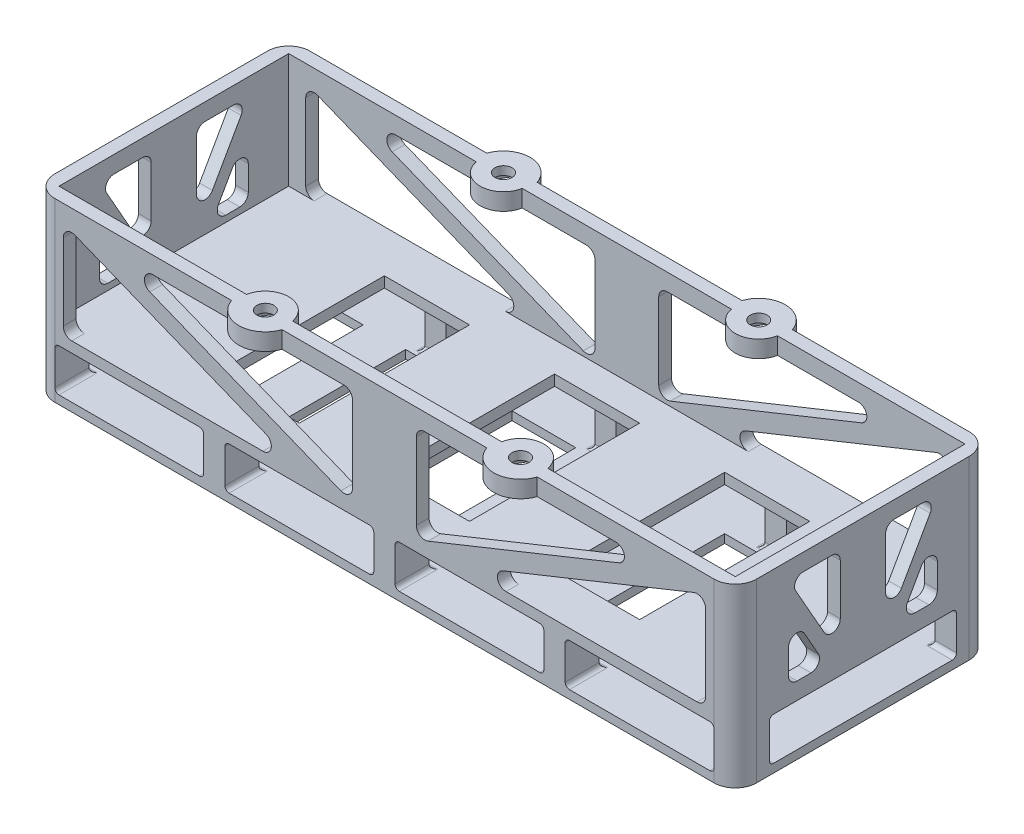
from build123d import *

# Parameters (mm, degrees)
SKETCH_1_W               = 165
SKETCH_1_H               = 60
SKETCH_1_W_2             = 20
SKETCH_1_H_2             = 40
EXTRUDE_1_DEPTH          = 2.5
EXTRUDE_3_DEPTH          = 27
CUT_EXTRUDE_3_DEPTH      = 102.630458033
CUT_EXTRUDE_3_DEPTH_BACK = 102.630458033
SKETCH_21_R              = 6.25
EXTRUDE_6_DEPTH          = 4
CUT_EXTRUDE_4_DEPTH      = 169.188324506
CUT_EXTRUDE_4_DEPTH_BACK = 169.188324506
SKETCH_15_R              = 2
CUT_EXTRUDE_5_DEPTH      = 93.895438532
CUT_EXTRUDE_START        = -27
CUT_EXTRUDE_6_DEPTH      = 27
CUT_EXTRUDE_7_DEPTH      = 2
SKETCH_18_W              = 158.987632604
SKETCH_18_H              = 54
CUT_EXTRUDE_8_DEPTH      = 15
SKETCH_19_W              = 5
SKETCH_19_H              = 8
SKETCH_19_H_2            = 7.99069016
EXTRUDE_4_DEPTH          = 10
SKETCH_20_W              = 165
SKETCH_20_H              = 60
SKETCH_20_W_2            = 15
SKETCH_20_H_2            = 40
EXTRUDE_5_DEPTH          = 2
FILLET_2_R               = 2
FILLET_3_R               = 5
FILLET_4_R               = 1


with BuildPart() as part:
    # 草圖1 → 填料-伸長1 (new body)
    with BuildSketch(Plane(origin=(0, 0, 0), x_dir=(1, 0, 0), z_dir=(0, 1, 0))):
        Rectangle(SKETCH_1_W, SKETCH_1_H)
        with Locations((40, 0)):
            Rectangle(SKETCH_1_W_2, SKETCH_1_H_2, mode=Mode.SUBTRACT)
        Rectangle(SKETCH_1_W_2, SKETCH_1_H_2, mode=Mode.SUBTRACT)
        with Locations((-40, 0)):
            Rectangle(SKETCH_1_W_2, SKETCH_1_H_2, mode=Mode.SUBTRACT)
    extrude(amount=EXTRUDE_1_DEPTH)

    # 草圖3 → 填料-伸長3 (add)
    with BuildSketch(Plane(origin=(0, 2.5, 0), x_dir=(1, 0, 0), z_dir=(0, 1, 0))):
        Polygon((-82.5, -30), (-20, -30), (20, -30), (82.5, -30), (82.5, 0), (82.5, 30), (20, 30), (-20, 30), (-82.5, 30), (-82.5, 0), align=None)
        Polygon((-20, -21.5), (-79.5, -21.5), (-79.5, 0), (-79.5, 21.5), (-20, 21.5), (20, 21.5), (79.5, 21.5), (79.5, 0), (79.5, -21.5), (20, -21.5), align=None, mode=Mode.SUBTRACT)
    extrude(amount=EXTRUDE_3_DEPTH)

    # 草圖6 → 除料-伸長3 (cut, two sides: drawn at the far end of the back side and taken through both)
    with BuildSketch(Plane.XY.offset(-21.5).offset(-CUT_EXTRUDE_3_DEPTH_BACK)):
        Polygon((-64.767243955, 25.5), (-7.5, 25.5), (-7.5, 2.5), align=None)
        Polygon((-75.5, 25.5), (-75.5, 2.5), (-18.232756045, 2.5), align=None)
        Polygon((7.5, 25.5), (7.5, 2.5), (64.767243955, 25.5), align=None)
        Polygon((75.5, 2.5), (18.232756045, 2.5), (75.5, 25.5), align=None)
    extrude(amount=CUT_EXTRUDE_3_DEPTH + CUT_EXTRUDE_3_DEPTH_BACK, mode=Mode.SUBTRACT)

    # 草圖21 → 填料-伸長6 (add)
    with BuildSketch(Plane(origin=(0, 29.5, 0), x_dir=(1, 0, 0), z_dir=(0, 1, 0))):
        with Locations((-30, 28)):
            Circle(SKETCH_21_R)
        with Locations((30, 28)):
            Circle(SKETCH_21_R)
        with Locations((30, -28)):
            Circle(SKETCH_21_R)
        with Locations((-30, -28)):
            Circle(SKETCH_21_R)
    extrude(amount=-EXTRUDE_6_DEPTH)

    # 草圖7 → 除料-伸長4 (cut, two sides: drawn at the far end of the back side and taken through both)
    with BuildSketch(Plane.ZY.offset(-79.5).offset(-CUT_EXTRUDE_4_DEPTH_BACK)):
        Polygon((17.5, 25.5), (5.321878443, 4), (5.321878443, 25.5), align=None)
        Polygon((-5.321878443, 4), (-5.321878443, 25.5), (-17.5, 25.5), align=None)
        Polygon((17.5, 4), (8.7697079, 4), (17.5, 19.41299118), align=None)
        Polygon((-17.5, 19.41299118), (-17.5, 4), (-8.7697079, 4), align=None)
    extrude(amount=CUT_EXTRUDE_4_DEPTH + CUT_EXTRUDE_4_DEPTH_BACK, mode=Mode.SUBTRACT)

    # 草圖15 → 除料-伸長5 (cut, through all)
    with BuildSketch(Plane.XZ.offset(-25.5)):
        with Locations((30, 28)):
            Circle(SKETCH_15_R)
        with Locations(Location((-30, 28, 0), (0, 0, 180))):
            Circle(SKETCH_15_R)
        with Locations(Location((30, -28, 0), (0, 0, 180))):
            Circle(SKETCH_15_R)
        with Locations((-30, -28)):
            Circle(SKETCH_15_R)
    extrude(amount=-CUT_EXTRUDE_5_DEPTH, mode=Mode.SUBTRACT)

    # 草圖16 → 除料-伸長6 (cut)
    with BuildSketch(Plane(origin=(0, 29.5, 0), x_dir=(1, 0, 0), z_dir=(0, 1, 0)).offset(CUT_EXTRUDE_START)):
        with BuildLine():
            Line((-35.408326913, 27), (-79.5, 27))
            Line((-79.5, 27), (-79.5, -27))
            Line((-79.5, -27), (-35.408326913, -27))
            ThreePointArc((-35.408326913, -27), (-30, -22.5), (-24.591673087, -27))
            Line((-24.591673087, -27), (24.591673087, -27))
            ThreePointArc((24.591673087, -27), (30, -22.5), (35.408326913, -27))
            Line((35.408326913, -27), (79.5, -27))
            Line((79.5, -27), (79.5, 27))
            Line((79.5, 27), (35.408326913, 27))
            ThreePointArc((35.408326913, 27), (30, 22.5), (24.591673087, 27))
            Line((24.591673087, 27), (-24.591673087, 27))
            ThreePointArc((-24.591673087, 27), (-30, 22.5), (-35.408326913, 27))
        make_face()
    extrude(amount=CUT_EXTRUDE_6_DEPTH, mode=Mode.SUBTRACT)

    # 草圖17 → 除料-伸長7 (cut)
    with BuildSketch(Plane.XZ.offset(-25.5)):
        Polygon((25.438932873, 28), (27.719466437, 31.95), (32.280533563, 31.95), (34.561067127, 28), (32.280533563, 24.05), (27.719466437, 24.05), align=None)
        Polygon((-27.719466437, 31.95), (-32.280533563, 31.95), (-34.561067127, 28), (-32.280533563, 24.05), (-27.719466437, 24.05), (-25.438932873, 28), align=None)
        Polygon((27.719466437, -31.95), (32.280533563, -31.95), (34.561067127, -28), (32.280533563, -24.05), (27.719466437, -24.05), (25.438932873, -28), align=None)
        Polygon((-25.438932873, -28), (-27.719466437, -31.95), (-32.280533563, -31.95), (-34.561067127, -28), (-32.280533563, -24.05), (-27.719466437, -24.05), align=None)
    extrude(amount=-CUT_EXTRUDE_7_DEPTH, mode=Mode.SUBTRACT)

    # 草圖18 → 除料-伸長8 (cut)
    with BuildSketch(Plane(origin=(0, 2.5, 0), x_dir=(1, 0, 0), z_dir=(0, 1, 0))):
        Rectangle(SKETCH_18_W, SKETCH_18_H)
    extrude(amount=CUT_EXTRUDE_8_DEPTH, mode=Mode.SUBTRACT)

    # 草圖19 → 填料-伸長4 (add)
    with BuildSketch(Plane.XZ):
        with Locations((-80, 26)):
            Rectangle(SKETCH_19_W, SKETCH_19_H)
        with Locations((-80, -26)):
            Rectangle(SKETCH_19_W, SKETCH_19_H)
        with Locations((80, -26)):
            Rectangle(SKETCH_19_W, SKETCH_19_H)
        with Locations((80, 26)):
            Rectangle(SKETCH_19_W, SKETCH_19_H)
        with Locations((40, -26)):
            Rectangle(SKETCH_19_W, SKETCH_19_H)
        with Locations((-40, 26.00465492)):
            Rectangle(SKETCH_19_W, SKETCH_19_H_2)
        with Locations((0, 26)):
            Rectangle(SKETCH_19_W, SKETCH_19_H)
        with Locations((40, 26)):
            Rectangle(SKETCH_19_W, SKETCH_19_H)
        with Locations((0, -26)):
            Rectangle(SKETCH_19_W, SKETCH_19_H)
        with Locations((-40, -26.00465492)):
            Rectangle(SKETCH_19_W, SKETCH_19_H_2)
    extrude(amount=EXTRUDE_4_DEPTH)

    # 草圖20 → 填料-伸長5 (add)
    with BuildSketch(Plane.XZ.offset(10)):
        Rectangle(SKETCH_20_W, SKETCH_20_H)
        with Locations((12.5, 0)):
            Rectangle(SKETCH_20_W_2, SKETCH_20_H_2, mode=Mode.SUBTRACT)
        with Locations((-12.5, 0)):
            Rectangle(SKETCH_20_W_2, SKETCH_20_H_2, mode=Mode.SUBTRACT)
        with Locations((37.5, 0)):
            Rectangle(SKETCH_20_W_2, SKETCH_20_H_2, mode=Mode.SUBTRACT)
        with Locations((62.5, 0)):
            Rectangle(SKETCH_20_W_2, SKETCH_20_H_2, mode=Mode.SUBTRACT)
        with Locations((-62.5, 0)):
            Rectangle(SKETCH_20_W_2, SKETCH_20_H_2, mode=Mode.SUBTRACT)
        with Locations((-37.5, 0)):
            Rectangle(SKETCH_20_W_2, SKETCH_20_H_2, mode=Mode.SUBTRACT)
    extrude(amount=EXTRUDE_5_DEPTH)

    # 圓角2
    fillet_2_edges = [part.edges().sort_by_distance(p)[0] for p in [
        (-7.5, 25.5, -28.5),
        (-7.5, 2.5, -28.5),
        (-64.767243955, 25.5, -28.5),
        (7.5, 25.5, -28.5),
        (64.767243955, 25.5, -28.5),
        (7.5, 2.5, -28.5),
        (75.5, 25.5, -28.5),
        (75.5, 2.5, -28.5),
        (18.232756045, 2.5, -28.5),
        (-18.232756045, 2.5, -28.5),
        (-75.5, 2.5, -28.5),
        (-75.5, 25.5, -28.5),
        (81, 19.41299118, -17.5),
        (81, 4, -8.7697079),
        (81, 4, -17.5),
        (-81, 19.41299118, -17.5),
        (-81, 4, -8.7697079),
        (-81, 4, -17.5),
        (81, 25.5, 5.321878443),
        (81, 25.5, 17.5),
        (81, 4, 5.321878443),
        (-81, 25.5, 5.321878443),
        (-81, 25.5, 17.5),
        (-81, 4, 5.321878443),
        (81, 19.41299118, 17.5),
        (81, 4, 17.5),
        (81, 4, 8.7697079),
        (-81, 19.41299118, 17.5),
        (-81, 4, 17.5),
        (-81, 4, 8.7697079),
        (81, 4, -5.321878443),
        (81, 25.5, -17.5),
        (81, 25.5, -5.321878443),
        (-81, 4, -5.321878443),
        (-81, 25.5, -17.5),
        (-81, 25.5, -5.321878443),
        (-64.767243955, 25.5, 28.5),
        (-7.5, 25.5, 28.5),
        (-7.5, 2.5, 28.5),
        (7.5, 25.5, 28.5),
        (7.5, 2.5, 28.5),
        (64.767243955, 25.5, 28.5),
        (75.5, 25.5, 28.5),
        (18.232756045, 2.5, 28.5),
        (75.5, 2.5, 28.5),
        (-18.232756045, 2.5, 28.5),
        (-75.5, 25.5, 28.5),
        (-75.5, 2.5, 28.5),
    ]]
    fillet(fillet_2_edges, radius=FILLET_2_R)

    # 圓角3
    fillet_3_edges = [part.edges().sort_by_distance(p)[0] for p in [
        (82.5, 8.75, -30),
        (82.5, 8.75, 30),
        (-82.5, 8.75, 30),
        (-82.5, 8.75, -30),
    ]]
    fillet(fillet_3_edges, radius=FILLET_3_R - 0.0001)  # a hair under: the kernel refuses the full size

    # 圓角4
    fillet_4_edges = [part.edges().sort_by_distance(p)[0] for p in [
        (-80, 0, 22),
        (-77.5, 0, 26),
        (-80, -10, 22),
        (-77.5, -10, 26),
        (-77.5, 0, -26),
        (-80, 0, -22),
        (-77.5, -10, -26),
        (-80, -10, -22),
        (80, 0, -22),
        (77.5, 0, -26),
        (80, -10, -22),
        (77.5, -10, -26),
        (77.5, 0, 26),
        (80, 0, 22),
        (77.5, -10, 26),
        (80, -10, 22),
        (-42.5, 0, 26.00465492),
        (-40, 0, 22.00930984),
        (-37.5, 0, 26.00465492),
        (-42.5, -10, 26.00465492),
        (-40, -10, 22.00930984),
        (-37.5, -10, 26.00465492),
        (37.5, 0, -26),
        (42.5, 0, -26),
        (40, 0, -22),
        (37.5, -10, -26),
        (42.5, -10, -26),
        (40, -10, -22),
        (-2.5, 0, 26),
        (0, 0, 22),
        (2.5, 0, 26),
        (-2.5, -10, 26),
        (0, -10, 22),
        (2.5, -10, 26),
        (-2.5, 0, -26),
        (2.5, 0, -26),
        (0, 0, -22),
        (-2.5, -10, -26),
        (2.5, -10, -26),
        (0, -10, -22),
        (37.5, 0, 26),
        (40, 0, 22),
        (42.5, 0, 26),
        (37.5, -10, 26),
        (40, -10, 22),
        (42.5, -10, 26),
        (-42.5, 0, -26.00465492),
        (-37.5, 0, -26.00465492),
        (-40, 0, -22.00930984),
        (-42.5, -10, -26.00465492),
        (-37.5, -10, -26.00465492),
        (-40, -10, -22.00930984),
    ]]
    fillet(fillet_4_edges, radius=FILLET_4_R)


solid = part.part
